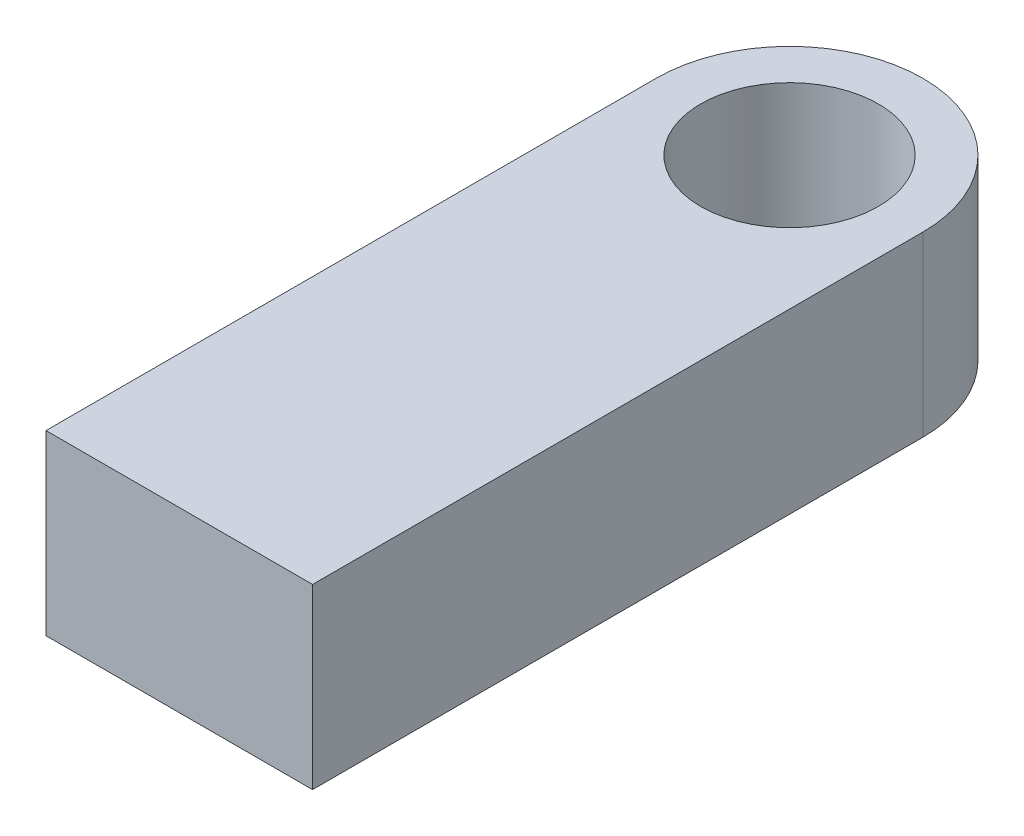
from build123d import *

# Parameters (mm, degrees)
SKETCH1_R           = 10
BOSS_EXTRUDE1_DEPTH = 20


with BuildPart() as part:
    # Sketch1 → Boss-Extrude1 (new body)
    with BuildSketch(Plane(origin=(0, 0, 0), x_dir=(1, 0, 0), z_dir=(0, 1, 0))):
        with BuildLine():
            Line((-15, 0), (-15, -68.679853718))
            Line((-15, -68.679853718), (15, -68.679853718))
            Line((15, -68.679853718), (15, 0))
            ThreePointArc((15, 0), (0, 15), (-15, 0))
        make_face()
        Circle(SKETCH1_R, mode=Mode.SUBTRACT)
    extrude(amount=BOSS_EXTRUDE1_DEPTH)


solid = part.part
